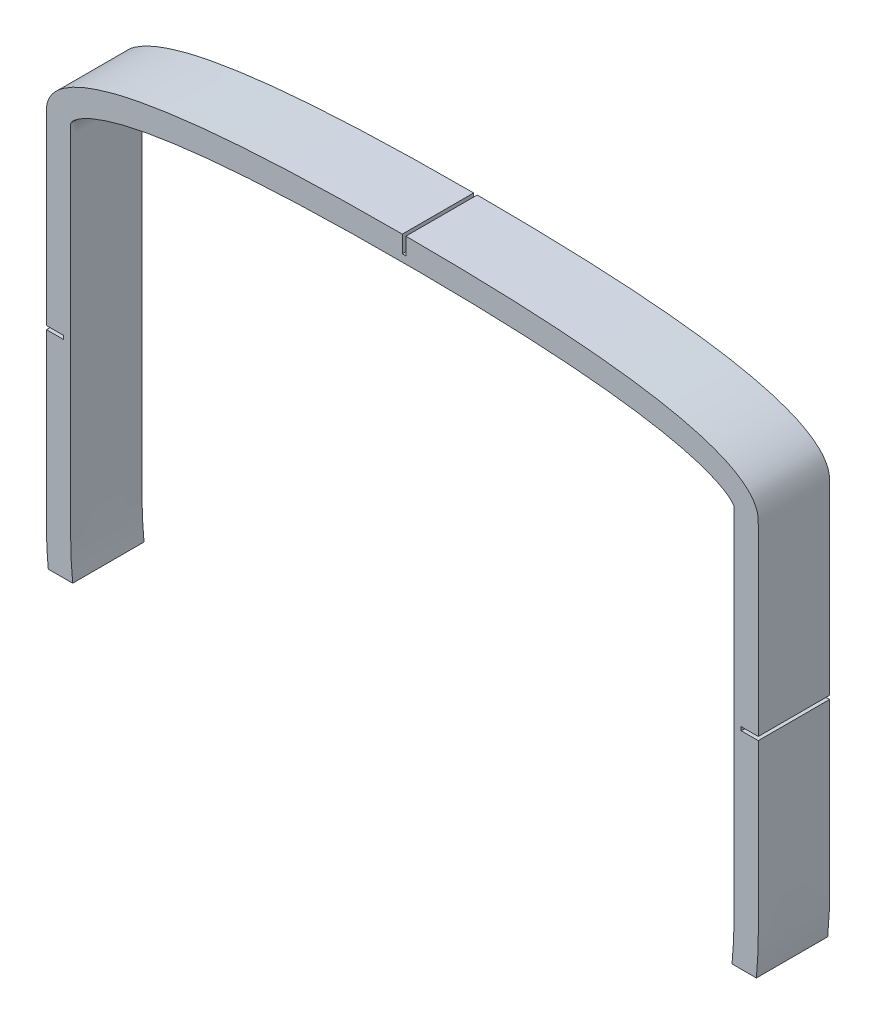
from build123d import *

# Parameters (mm, degrees)
BOSS_EXTRUDE1_START = -10
BOSS_EXTRUDE1_DEPTH = 20
SKETCH2_W           = 250
SKETCH2_H           = 75
CUT_EXTRUDE1_DEPTH  = 158.203187564


# Read off the part's stored shape, not the designer's step: Boss-Extrude1
with BuildPart() as part:
    # Boss-Extrude1 outline → Boss-Extrude1 (new body)
    with BuildSketch(Plane.XY.offset(BOSS_EXTRUDE1_START)):
        with BuildLine():
            Line((1, 115.006810227), (0, 115.006810227))
            Line((0, 115.006810227), (0, 119.801990271))
            add(Edge.make_bspline(
                [(0, 119.801990271), (-2.27574283, 119.801594105), (-8.080052766, 119.779035285), (-17.418616824, 119.658563661), (-28.020749242, 119.370598285), (-38.634834441, 118.900042221), (-49.263994287, 118.195660199), (-58.13525568, 117.350230931), (-65.248057918, 116.451417193), (-70.587886107, 115.637667365), (-75.94234067, 114.643364254), (-80.414328561, 113.614336255), (-84.011794221, 112.606570277), (-86.715444626, 111.737306732), (-88.990738285, 110.875491127), (-90.811622866, 110.078868363), (-92.196773222, 109.402861837), (-93.584786341, 108.637685085), (-94.773007795, 107.876037667), (-95.717641092, 107.178431545), (-96.449965322, 106.576000015), (-97.186184014, 105.883016407), (-97.928763991, 105.062911858), (-98.573473095, 104.17184846), (-99.06327665, 103.27043995), (-99.393526391, 102.489659032), (-99.614870682, 101.719827952), (-99.727313202, 101.084699763), (-99.769423265, 100.710384113), (-99.790336747, 100.411353638), (-99.799235979, 100.166724504), (-99.800205476, 99.984508899), (-99.799847623, 99.869027792), (-99.799823906, 99.74060093), (-99.799792486, 99.523798108), (-99.80002485, 99.25143402), (-99.800288052, 98.810752814), (-99.800517977, 98.261733031), (-99.800636847, 97.602387822), (-99.800637755, 96.723799284), (-99.800418096, 95.626005841), (-99.800042438, 94.309623403), (-99.799832205, 92.994001879), (-99.799782847, 91.239340091), (-99.799981835, 89.045558241), (-99.800160348, 86.412399842), (-99.800244895, 83.779420706), (-99.800272173, 80.268756937), (-99.800180454, 75.88050538), (-99.800003308, 70.614722004), (-99.79990146, 65.349029555), (-99.799872223, 60.083306937), (-99.799895543, 54.203808889), (-99.799951916, 50.079547639), (-99.799985006, 47.710523193)],
                knots=[0.146172135, 0.146172135, 0.146172135, 0.146172135, 0.15625, 0.171875, 0.1875, 0.203125, 0.21875, 0.234375, 0.2421875, 0.25, 0.2578125, 0.265625, 0.26953125, 0.2734375, 0.27734375, 0.279296875, 0.28125, 0.283203125, 0.28515625, 0.286132812, 0.287109375, 0.288085938, 0.2890625, 0.290039062, 0.290527344, 0.291015625, 0.291503906, 0.291748047, 0.291992188, 0.292114258, 0.292236328, 0.292358398, 0.292480469, 0.292724609, 0.29296875, 0.293457031, 0.293945312, 0.294921875, 0.295898438, 0.296875, 0.298828125, 0.30078125, 0.302734375, 0.3046875, 0.30859375, 0.3125, 0.31640625, 0.3203125, 0.328125, 0.3359375, 0.34375, 0.3515625, 0.359375, 0.369919362, 0.369919362, 0.369919362, 0.369919362], degree=3))
            Line((-99.799985006, 47.710523193), (-95.027429235, 47.710523193))
            Line((-95.027429235, 47.710523193), (-95.027429235, 46.710523193))
            Line((-95.027429235, 46.710523193), (-99.799998982, 46.710523193))
            add(Edge.make_bspline(
                [(-99.799998982, 46.710523193), (-99.800010254, 45.902377698), (-99.800069838, 41.583720638), (-99.80014587, 33.754485116), (-99.800505635, 23.223179801), (-99.799679386, 14.4459308), (-99.801136798, 7.426624709), (-99.796894787, 3.033822239), (-99.805308217, -0.465987616), (-99.759141694, -4.156711462), (-99.438712731, -10.542299727), (-98.294238748, -19.729972222), (-95.501671637, -30.617877434), (-91.007467852, -41.089742593), (-84.652074349, -50.663569653), (-76.600245778, -58.862795915), (-67.302957766, -65.435861427), (-53.896056792, -72.115410588), (-36.165000884, -77.150562875), (-18.187624636, -79.297714349), (-6.174368209, -79.759810132), (-1.346346859, -79.801016691), (-0.1, -79.801808559)],
                knots=[0.371403005, 0.371403005, 0.371403005, 0.371403005, 0.375, 0.390625, 0.40625, 0.421875, 0.4296875, 0.4375, 0.44140625, 0.4453125, 0.453125, 0.46875, 0.484375, 0.5, 0.515625, 0.53125, 0.546875, 0.5625, 0.59375, 0.625, 0.640625, 0.64606282, 0.64606282, 0.64606282, 0.64606282], degree=3))
            Line((-0.1, -79.801808559), (-0.1, -75.146205503))
            Line((-0.1, -75.146205503), (0.3, -75.146205503))
            Line((0.3, -75.146205503), (0.3, -79.801724394))
            add(Edge.make_bspline(
                [(0.3, -79.801724394), (2.501532566, -79.799397871), (11.86466932, -79.658552731), (28.468647656, -78.393184478), (49.892541186, -73.78340807), (67.095318032, -66.050228552), (79.086640147, -56.648120321), (86.680517748, -48.016317429), (92.501583857, -38.117867323), (96.476354993, -27.483349983), (98.433155067, -18.360856768), (99.337729137, -11.029098552), (99.655135353, -6.445613725), (99.780918083, -2.7912996), (99.804296451, -0.038361832), (99.799067761, 2.584352582), (99.800472354, 6.091701714), (99.799858203, 10.482871902), (99.800080901, 17.502278893), (99.799972511, 26.279386709), (99.80000668, 36.600090582), (99.800001461, 43.410579077), (99.80000022, 46.710523193)],
                knots=[0.646644559, 0.646644559, 0.646644559, 0.646644559, 0.65625, 0.6875, 0.71875, 0.75, 0.765625, 0.78125, 0.796875, 0.8125, 0.828125, 0.8359375, 0.84375, 0.84765625, 0.8515625, 0.85546875, 0.859375, 0.8671875, 0.875, 0.890625, 0.90625, 0.920937729, 0.920937729, 0.920937729, 0.920937729], degree=3))
            Line((99.80000022, 46.710523193), (95.027429235, 46.710523193))
            Line((95.027429235, 46.710523193), (95.027429235, 47.710523193))
            Line((95.027429235, 47.710523193), (99.799999891, 47.710523193))
            add(Edge.make_bspline(
                [(99.799999891, 47.710523193), (99.799998951, 51.098291529), (99.800000246, 56.24130001), (99.799999953, 63.139577639), (99.800000013, 68.405348483), (99.799999997, 73.671119926), (99.800000001, 78.936891125), (99.799999999, 83.325034106), (99.800000002, 86.835547857), (99.799999994, 89.468434883), (99.800000017, 91.66250196), (99.799999971, 93.417767831), (99.800000113, 94.734183873), (99.799999668, 95.831303359), (99.800000573, 96.708760922), (99.799997771, 97.367504686), (99.800007811, 98.023774591), (99.799972215, 98.578528019), (99.80002125, 99.006164906), (99.800066327, 99.295458307), (99.799683962, 99.514410156), (99.799726653, 99.677266334), (99.802643895, 99.88249116), (99.799343805, 100.0793429), (99.79769376, 100.17776877), (99.791771211, 100.404638105), (99.756702617, 100.866154781), (99.681026069, 101.371255742), (99.474830418, 102.302594526), (98.978403603, 103.522379935), (98.211060015, 104.706394838), (97.450923574, 105.606725476), (96.716844631, 106.336037386), (95.739744321, 107.177590333), (94.550465009, 108.03359409), (93.145100655, 108.89131757), (91.75533098, 109.626968724), (90.375947661, 110.276323768), (88.554940758, 111.047853828), (86.286312413, 111.884188002), (83.582091496, 112.733611142), (80.886327919, 113.473235038), (77.306216569, 114.338576161), (72.837150711, 115.246978295), (67.491102847, 116.127565447), (62.153711112, 116.857717776), (55.050159396, 117.6648435), (46.179815673, 118.430829138), (35.555435733, 119.056758148), (24.944271633, 119.472818285), (13.423611988, 119.731950539), (5.447648262, 119.797539598), (1, 119.801619303)],
                knots=[0.922421363, 0.922421363, 0.922421363, 0.922421363, 0.9375, 0.9453125, 0.953125, 0.9609375, 0.96875, 0.9765625, 0.98046875, 0.984375, 0.98828125, 0.990234375, 0.9921875, 0.994140625, 0.995117188, 0.99609375, 0.997070312, 0.998046875, 0.998535156, 0.999023438, 0.999267578, 0.999511719, 1, 1, 1, 1.000244141, 1.000488281, 1.000732422, 1.000976562, 1.001953125, 1.002929688, 1.00390625, 1.004882812, 1.005859375, 1.0078125, 1.009765625, 1.01171875, 1.013671875, 1.015625, 1.01953125, 1.0234375, 1.02734375, 1.03125, 1.0390625, 1.046875, 1.0546875, 1.0625, 1.078125, 1.09375, 1.109375, 1.125, 1.144696002, 1.144696002, 1.144696002, 1.144696002], degree=3))
            Line((1, 119.801619303), (1, 115.006810227))
        make_face()
        with BuildLine():
            add(Edge.make_bspline(
                [(93.000273415, 99.966907024), (92.999171591, 100.103465997), (92.992651206, 100.132402113), (92.923379564, 100.342487851), (92.741953275, 100.634971482), (92.35758544, 101.097736525), (91.716644477, 101.68904144), (90.799079636, 102.354124136), (89.791526009, 102.971098991), (88.36453533, 103.727774967), (86.471297456, 104.566952964), (84.1036332, 105.441274947), (80.85825298, 106.461659663), (76.698192589, 107.522174207), (71.619482465, 108.555344305), (64.771072996, 109.684098586), (56.129575552, 110.745941464), (45.697381236, 111.647128503), (35.226512222, 112.264293999), (24.738459003, 112.675618223), (10.738264864, 112.990672608), (-3.277739106, 113.040443738), (-17.285093648, 112.859646832), (-27.782292834, 112.574458931), (-38.265799371, 112.109518062), (-48.725549016, 111.416151999), (-57.408368252, 110.587988459), (-64.314341991, 109.715139804), (-69.464988263, 108.929723515), (-74.570491377, 107.981593999), (-79.604619188, 106.819710944), (-83.699695879, 105.607708308), (-86.839739053, 104.417082252), (-88.714649824, 103.557497699), (-90.121841476, 102.779943954), (-91.101574019, 102.148762606), (-91.980155172, 101.469023514), (-92.569508897, 100.867472317), (-92.869055065, 100.442525863), (-92.964886628, 100.226011015), (-92.987474054, 100.150064627), (-92.997029441, 100.071779107), (-92.999952708, 100.043201705), (-93.000025213, 99.917086062), (-92.999778783, 99.739621003), (-92.99984395, 99.412706838), (-93.000272095, 98.91647059), (-93.000510407, 98.259878337), (-93.000638891, 97.601790672), (-93.000636489, 96.724677564), (-93.000419491, 95.627870135), (-92.999913297, 93.872483229), (-92.999735656, 91.677787579), (-92.999983946, 89.044870904), (-93.000217929, 85.534518323), (-93.000289334, 81.146448153), (-93.00018081, 75.880721679), (-93.000003086, 70.614923307), (-92.999868318, 63.593831775), (-92.999873146, 54.817522455), (-93.000042204, 44.28597065), (-93.000149658, 33.754472412), (-93.000491878, 23.222830773), (-92.999719793, 14.446949225), (-93.00106682, 7.425180776), (-92.997105725, 3.03901109), (-93.00494255, -0.476039719), (-92.961457886, -3.91120845), (-92.659522768, -9.947357116), (-91.590601344, -18.482571736), (-89.029619662, -28.44557549), (-84.983873161, -37.854874318), (-79.336343484, -46.356012097), (-72.188938862, -53.639611363), (-63.824814081, -59.561828972), (-51.547785272, -65.688816014), (-34.893418907, -70.44405447), (-17.640410915, -72.512575571), (-3.735469128, -73.048325897), (10.195921997, -72.964975484), (27.54287396, -71.636761353), (47.858148584, -67.244471369), (63.666960385, -60.095633791), (74.402047502, -51.664893782), (81.133870986, -44.011305834), (86.321357909, -35.199505991), (89.919058971, -25.595627049), (92.079730337, -15.534384961), (92.897080004, -6.940511221), (93.0183194, -0.067404882), (92.989359826, 6.982133451), (93.00361404, 15.743984978), (92.99903151, 26.280156442), (93.00025992, 36.810458217), (92.99992881, 47.342335285), (93.000008834, 56.118539942), (92.999998337, 63.13957898), (93.000000444, 68.405348061), (92.999999887, 73.671120274), (93.000000007, 78.936890156), (93.000000071, 83.325036886), (92.999999871, 86.835543048), (93.000000495, 89.468453237), (92.999998151, 92.101246767), (93.000005444, 94.295604768), (92.999990571, 96.050277354), (93.000028418, 97.148800579), (92.999950467, 98.023373705), (93.000183315, 98.690847478), (92.999262146, 99.313048279), (93.001375238, 99.830348052), (93.000273415, 99.966907024)],
                knots=[0, 0, 0, 0, 0.000976562, 0.001953125, 0.002929688, 0.00390625, 0.005859375, 0.0078125, 0.009765625, 0.01171875, 0.015625, 0.01953125, 0.0234375, 0.03125, 0.0390625, 0.046875, 0.0625, 0.078125, 0.09375, 0.109375, 0.125, 0.15625, 0.171875, 0.1875, 0.203125, 0.21875, 0.234375, 0.2421875, 0.25, 0.2578125, 0.265625, 0.2734375, 0.27734375, 0.28125, 0.283203125, 0.28515625, 0.287109375, 0.2890625, 0.290039062, 0.291015625, 0.291503906, 0.291992188, 0.292236328, 0.292480469, 0.292724609, 0.29296875, 0.293945312, 0.294921875, 0.295898438, 0.296875, 0.298828125, 0.30078125, 0.3046875, 0.30859375, 0.3125, 0.3203125, 0.328125, 0.3359375, 0.34375, 0.359375, 0.375, 0.390625, 0.40625, 0.421875, 0.4296875, 0.4375, 0.44140625, 0.4453125, 0.453125, 0.46875, 0.484375, 0.5, 0.515625, 0.53125, 0.546875, 0.5625, 0.59375, 0.625, 0.640625, 0.65625, 0.6875, 0.71875, 0.75, 0.765625, 0.78125, 0.796875, 0.8125, 0.828125, 0.84375, 0.8515625, 0.859375, 0.875, 0.890625, 0.90625, 0.921875, 0.9375, 0.9453125, 0.953125, 0.9609375, 0.96875, 0.9765625, 0.98046875, 0.984375, 0.98828125, 0.9921875, 0.994140625, 0.99609375, 0.997070312, 0.998046875, 0.999023438, 1, 1, 1, 1], degree=3))
        make_face(mode=Mode.SUBTRACT)
    extrude(amount=BOSS_EXTRUDE1_DEPTH)

    # Sketch2 → Cut-Extrude1 (cut, through all)
    with BuildSketch(Plane.XY.offset(10)):
        with Locations((-0.1, -48.698032574)):
            Rectangle(SKETCH2_W, SKETCH2_H)
    extrude(amount=-CUT_EXTRUDE1_DEPTH, mode=Mode.SUBTRACT)


solid = part.part
